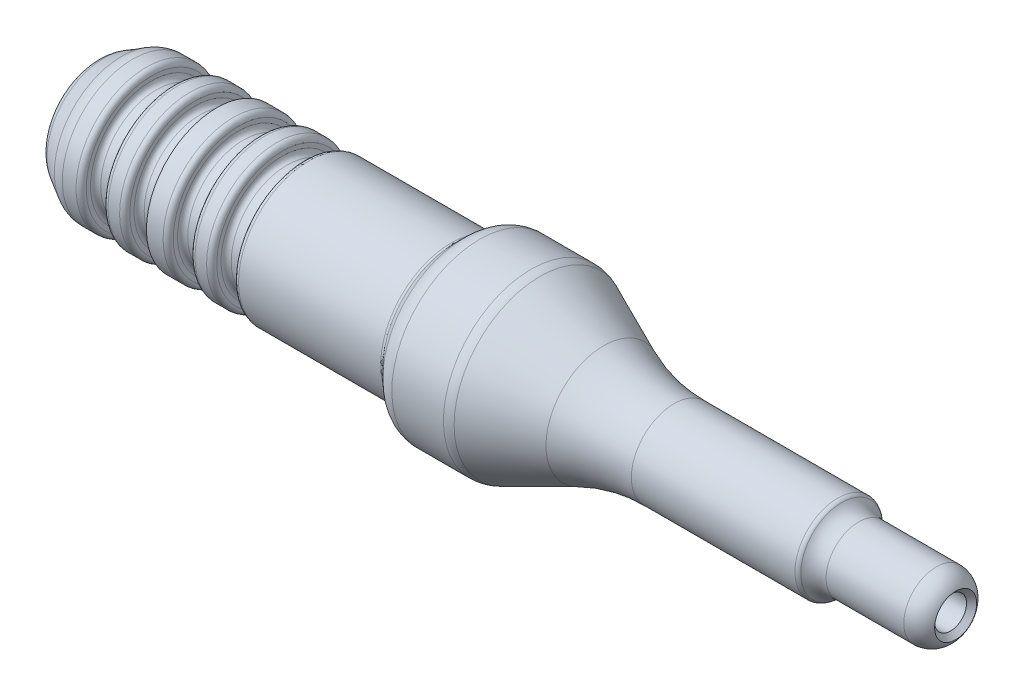
from build123d import *

# Parameters (mm, degrees)
SKETCH2_W     = 1.5000000000000018
SKETCH2_H     = 1.0000000000000004
SKETCH2_W_2   = 1.5
FILLET1_R     = 12
CHAMFER1_SIZE = 0.35
FILLET2_R     = 1.5
FILLET3_R     = 0.35


with BuildPart() as part:
    # Sketch1 → Revolve1 (revolve)
    with BuildSketch(Plane.XY, mode=Mode.PRIVATE) as revolve1_sk:
        Polygon((0, 0), (0, 3.52), (2.2999999999999994, 4.847905619136144), (24.8, 4.847905619136145), (26, 6.047905619136151), (30.5, 6.047905619136152), (37.5, 2.947394125108839), (51.5, 2.947394125108837), (51.90264068586285, 2.25), (59.452640685862846, 2.25), (59.452640685862846, -7e-17), align=None)
    revolve(revolve1_sk.sketch.rotate(Axis((0, 0, 0), (1, 0, 0)), 180), axis=Axis((0, 0, 0), (1, 0, 0)))

    # Sketch2 → Cut-Revolve1 (revolve, cut)
    with BuildSketch(Plane.XY, mode=Mode.PRIVATE) as cut_revolve1_sk:
        Polygon((0, 2.25), (33.5, 2.25), (35.491858428704205, 1.1), (59.452640685862846, 1.1), (59.452640685862846, 0), (0, 0), align=None)
        Polygon((6.999999999999998, 3.849999999999999), (8.5, 3.849999999999999), (8.5, 4.85), (6.999999999999999, 4.85), align=None)
        Polygon((3.999999999999999, 4.85), (5.5, 4.85), (5.5, 3.849999999999999), (3.9999999999999982, 3.849999999999999), align=None)
        with Locations((10.75, 4.35)):
            Rectangle(SKETCH2_W, SKETCH2_H)
        with Locations((13.750000000000002, 4.35)):
            Rectangle(SKETCH2_W_2, SKETCH2_H)
    revolve(cut_revolve1_sk.sketch.rotate(Axis((0, 0, 0), (1, 0, 0)), 90), axis=Axis((0, 0, 0), (1, 0, 0)), mode=Mode.SUBTRACT)

    # Fillet1
    fillet1_edges = [part.edges().sort_by_distance(p)[0] for p in [
        (37.5, 2.947394125108839, -7.2e-16),
    ]]
    fillet(fillet1_edges, radius=FILLET1_R)

    # Chamfer1
    chamfer1_edges = [part.edges().sort_by_distance(p)[0] for p in [
        (0, -5.3e-16, -2.25),
        (59.452640685862846, -2.6e-16, -1.1),
    ]]
    chamfer(chamfer1_edges, length=CHAMFER1_SIZE)

    # Fillet2
    # the kernel refuses this fillet: 1.5 mm, written as the material it adds along each edge
    with BuildSketch(Plane(origin=(51.90264068586285, -6e-17, 0), x_dir=(0, -1, 1.2e-16), z_dir=(0, 1.2e-16, 1))) as fillet2_piece_1:
        with BuildLine():
            CenterArc((3.75, 0.8645703500700748), FILLET2_R, 180, 57.65130167775095)
            Line((2.947394125108838, -0.40264068586284907), (2.931342007611015, -0.4279849065815071))
            ThreePointArc((2.931342007611015, -0.4279849065815071), (2.583697062554419, -0.22730110504495826), (2.235, -0.02598076211353373))
            Line((2.235, -0.02598076211353373), (2.22, 0))
            Line((2.22, 0), (2.22, 0.8645703500700748))
            Line((2.22, 0.8645703500700748), (2.25, 0.8645703500700748))
        make_face()
    revolve(axis=Axis((51.90264068586285, -6e-17, 0), (1, 0, 0)))
    # the kernel refuses this fillet: 1.5 mm, written as the material it takes off along each edge
    with BuildSketch(Plane(origin=(30.5, -4e-17, 0), x_dir=(0, -1, 1.2e-16), z_dir=(0, 1.2e-16, 1))) as fillet2_2_piece_1:
        with BuildLine():
            CenterArc((6.047905619136152 - FILLET2_R, -FILLET2_R * 0.211553464978), FILLET2_R, 0, 23.889999999999986)
            Line((6.047905619136152, -FILLET2_R * 0.211553464978), (6.047905619136152 + FILLET2_R * 0.02, -FILLET2_R * 0.211553464978))
            Line((6.047905619136152 + FILLET2_R * 0.02, -FILLET2_R * 0.211553464978), (6.047905619136152 + FILLET2_R * 0.02, FILLET2_R * 0.00423106929956))
            Line((6.047905619136152 + FILLET2_R * 0.02, FILLET2_R * 0.00423106929956), (6.047905619136152 - FILLET2_R * 0.0673888551076, FILLET2_R * 0.201528188479))
            Line((6.047905619136152 - FILLET2_R * 0.0673888551076, FILLET2_R * 0.201528188479), (6.047905619136152 - FILLET2_R * 0.0856753481447, FILLET2_R * 0.193428548215))
        make_face()
    revolve(axis=Axis((30.5, -4e-17, 0), (1, 0, 0)), mode=Mode.SUBTRACT)
    with BuildSketch(Plane(origin=(26, -3e-17, 0), x_dir=(0, -1, 1.2e-16), z_dir=(0, 1.2e-16, 1))) as fillet2_2_piece_2:
        with BuildLine():
            CenterArc((6.047905619136151 - FILLET2_R, FILLET2_R * 0.414213562373), FILLET2_R, 314.9999999999997, 45.000000000000284)
            Line((6.047905619136151 - FILLET2_R * 0.292893218813, -FILLET2_R * 0.292893218813), (6.047905619136151 - FILLET2_R * 0.27875108319, -FILLET2_R * 0.307035354437))
            Line((6.047905619136151 - FILLET2_R * 0.27875108319, -FILLET2_R * 0.307035354437), (6.047905619136151 + FILLET2_R * 0.02, -FILLET2_R * 0.00828427124746))
            Line((6.047905619136151 + FILLET2_R * 0.02, -FILLET2_R * 0.00828427124746), (6.047905619136151 + FILLET2_R * 0.02, FILLET2_R * 0.414213562373))
            Line((6.047905619136151 + FILLET2_R * 0.02, FILLET2_R * 0.414213562373), (6.047905619136151, FILLET2_R * 0.414213562373))
        make_face()
    revolve(axis=Axis((26, -3e-17, 0), (1, 0, 0)), mode=Mode.SUBTRACT)
    with BuildSketch(Plane(origin=(2.2999999999999994, 0, 0), x_dir=(0, -1, 1.2e-16), z_dir=(0, 1.2e-16, 1))) as fillet2_2_piece_3:
        with BuildLine():
            CenterArc((4.847905619136144 - FILLET2_R, FILLET2_R * 0.267949192431), FILLET2_R, 329.9999999999999, 30.0000000000001)
            Line((4.847905619136144, FILLET2_R * 0.267949192431), (4.847905619136144 + FILLET2_R * 0.02, FILLET2_R * 0.267949192431))
            Line((4.847905619136144 + FILLET2_R * 0.02, FILLET2_R * 0.267949192431), (4.847905619136144 + FILLET2_R * 0.02, -FILLET2_R * 0.00535898384862))
            Line((4.847905619136144 + FILLET2_R * 0.02, -FILLET2_R * 0.00535898384862), (4.847905619136144 - FILLET2_R * 0.11665408814, -FILLET2_R * 0.242050807569))
            Line((4.847905619136144 - FILLET2_R * 0.11665408814, -FILLET2_R * 0.242050807569), (4.847905619136144 - FILLET2_R * 0.133974596216, -FILLET2_R * 0.232050807569))
        make_face()
    revolve(axis=Axis((2.2999999999999994, 0, 0), (1, 0, 0)), mode=Mode.SUBTRACT)
    with BuildSketch(Plane(origin=(0, 0, 0), x_dir=(0, -1, 1.2e-16), z_dir=(0, 1.2e-16, 1))) as fillet2_2_piece_4:
        with BuildLine():
            CenterArc((3.52 - FILLET2_R * 0.57735026919, FILLET2_R), FILLET2_R, 270, 59.9999999999999)
            Line((3.52 + FILLET2_R * 0.288675134595, FILLET2_R * 0.5), (3.52 + FILLET2_R * 0.305995642671, FILLET2_R * 0.49))
            Line((3.52 + FILLET2_R * 0.305995642671, FILLET2_R * 0.49), (3.52 + FILLET2_R * 0.0115470053838, -FILLET2_R * 0.02))
            Line((3.52 + FILLET2_R * 0.0115470053838, -FILLET2_R * 0.02), (3.52 - FILLET2_R * 0.57735026919, -FILLET2_R * 0.02))
            Line((3.52 - FILLET2_R * 0.57735026919, -FILLET2_R * 0.02), (3.52 - FILLET2_R * 0.57735026919, 1e-17))
        make_face()
    revolve(axis=Axis((0, 0, 0), (1, 0, 0)), mode=Mode.SUBTRACT)
    with BuildSketch(Plane(origin=(59.452640685862846, -7e-17, 0), x_dir=(0, -1, 1.2e-16), z_dir=(0, 1.2e-16, 1))) as fillet2_2_piece_5:
        with BuildLine():
            CenterArc((0.7499999999999999, -1.3266499161421734), FILLET2_R, 0, 62.18186071534626)
            Line((2.25, -1.3266499161421734), (2.28, -1.3266499161421734))
            Line((2.28, -1.3266499161421734), (2.28, 0))
            Line((2.28, 0), (2.25, 0.03000000000000114))
            ThreePointArc((2.25, 0.03000000000000114), (1.8499999999999974, 0.03000000000000114), (1.4639999999999944, 0.0265329983228284))
            Line((1.4639999999999944, 0.0265329983228284), (1.4499999999999946, -1.421e-14))
        make_face()
    revolve(axis=Axis((59.452640685862846, -7e-17, 0), (1, 0, 0)), mode=Mode.SUBTRACT)

    # Fillet3
    fillet3_edges = [part.edges().sort_by_distance(p)[0] for p in [
        (51.5, 2.947394125108837, -7.2e-16),
        (24.8, 4.847905619136145, -1.19e-15),
        (14.5, -9e-16, -3.849999999999999),
        (14.5, 4.847905619136144, -1.19e-15),
        (13, -9e-16, -3.849999999999999),
        (13.000000000000002, 4.847905619136144, -1.19e-15),
        (11.5, -9e-16, -3.849999999999999),
        (11.5, 4.847905619136144, -1.19e-15),
        (9.999999999999998, -9e-16, -3.849999999999999),
        (9.999999999999998, 4.847905619136144, -1.19e-15),
        (8.5, -9e-16, -3.849999999999999),
        (6.999999999999998, -9e-16, -3.849999999999999),
        (6.999999999999998, 4.847905619136144, -1.19e-15),
        (5.5, -9e-16, -3.849999999999999),
        (3.9999999999999982, 4.847905619136144, -1.19e-15),
        (3.9999999999999982, -9e-16, -3.849999999999999),
        (5.5, 4.847905619136144, -1.19e-15),
    ]]
    fillet(fillet3_edges, radius=FILLET3_R)


solid = part.part
